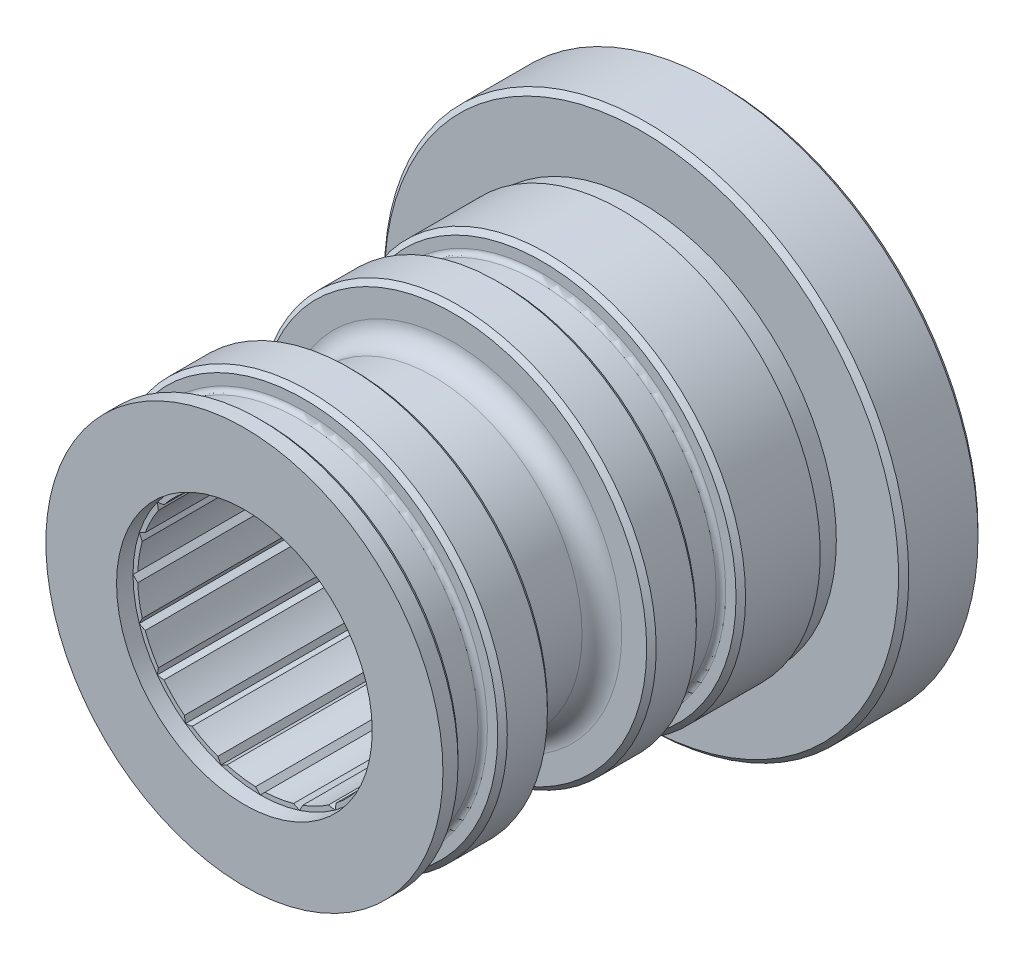
from build123d import *

# Parameters (mm, degrees)
SKETCH1_R              = 31.75
EXTRUDE1_DEPTH         = 76.2
SKETCH3_R              = 20.44096729
CUT_EXTRUDE1_DEPTH     = 2.54
CUT_EXTRUDE1_DRAFT     = -2
CUT_EXTRUDE2_DEPTH     = 27.94
CIRPATTERN1_COUNT      = 20
SKETCH5_R              = 19.60508264
CUT_EXTRUDE3_DEPTH     = 1.524
CUT_EXTRUDE3_DRAFT     = -2
FILLET1_R              = 0.8128
SKETCH7_R              = 41.91424822
EXTRUDE2_DEPTH         = 12.7
CHAMFER1_SIZE          = 0.8128
SKETCH8_W              = 0.8128
SKETCH8_H              = 3.175
COUNTERBORE1_OUTLINE_R = 25.4
COUNTERBORE1_DEPTH     = 9.525


# Read off the part's stored shape, not the designer's step: CounterBore1
with BuildPart() as part:
    # Sketch1 → Extrude1 (new body)
    with BuildSketch(Plane.XY):
        Circle(SKETCH1_R)
    extrude(amount=EXTRUDE1_DEPTH)


with BuildPart() as cut_extrude1_tool:
    # Sketch3 → Cut-Extrude1 (with draft: the straight prism first)
    with BuildSketch(Plane.XY.offset(76.2)):
        Circle(SKETCH3_R)
    extrude(amount=-CUT_EXTRUDE1_DEPTH)
    # Cut-Extrude1: the draft: its side faces are tilted about the plane it starts from
    cut_extrude1_sides = [cut_extrude1_tool.faces().sort_by_distance(p)[0] for p in [
        (-20.44096729, 0, 74.93),
    ]]
    draft(cut_extrude1_sides, Plane.XY.offset(76.2), CUT_EXTRUDE1_DRAFT)


with BuildPart() as part_1:
    add(part.part)

    # Cut-Extrude1: cut by cut_extrude1_tool
    add(cut_extrude1_tool.part, mode=Mode.SUBTRACT)

    # Sketch4 → Cut-Extrude2 (cut)
    with BuildSketch(Plane.XY.offset(73.66)):
        with BuildLine():
            Line((20.352268536, 0), (19.590268536, 0.762))
            ThreePointArc((19.590268536, 0.762), (-19.60508264, 0), (19.590268536, -0.762))
            Line((19.590268536, -0.762), (20.352268536, 0))
        make_face()
    cut_extrude2 = extrude(amount=-CUT_EXTRUDE2_DEPTH, mode=Mode.SUBTRACT)

    # CirPattern1: Cut-Extrude2 ×20 about axis
    cirpattern1_axis = Axis((0, 0, 0), (0, 0, 1))
    for i in range(1, CIRPATTERN1_COUNT):
        add(cut_extrude2.rotate(cirpattern1_axis, i * 360 / CIRPATTERN1_COUNT), mode=Mode.SUBTRACT)


with BuildPart() as cut_extrude3_tool:
    # Sketch5 → Cut-Extrude3 (with draft: the straight prism first)
    with BuildSketch(Plane.XY.offset(45.72)):
        Circle(SKETCH5_R)
    extrude(amount=-CUT_EXTRUDE3_DEPTH)
    # Cut-Extrude3: the draft: its side faces are tilted about the plane it starts from
    cut_extrude3_sides = [cut_extrude3_tool.faces().sort_by_distance(p)[0] for p in [
        (-19.60508264, 0, 44.958),
    ]]
    draft(cut_extrude3_sides, Plane.XY.offset(45.72), CUT_EXTRUDE3_DRAFT)


with BuildPart() as part_2:
    add(part_1.part)

    # Cut-Extrude3: cut by cut_extrude3_tool
    add(cut_extrude3_tool.part, mode=Mode.SUBTRACT)

    # Fillet1
    fillet1_edges = [part_2.edges().sort_by_distance(p)[0] for p in [
        (-19.551863387, 0, 44.196),
    ]]
    fillet(fillet1_edges, radius=FILLET1_R)

    # Sketch6 → Cut-Revolve1 (revolve, cut)
    with BuildSketch(Plane(origin=(0, 0, 0), x_dir=(0, 0, -1), z_dir=(1, 0, 0)), mode=Mode.PRIVATE) as cut_revolve1_sk:
        with BuildLine():
            Line((-65.913, 31.75), (-59.4995, 31.75))
            Line((-59.4995, 31.75), (-58.7375, 30.988))
            Line((-58.7375, 30.988), (-58.7375, 27.0002))
            ThreePointArc((-58.7375, 27.0002), (-57.80756403, 24.75513597), (-55.5625, 23.8252))
            Line((-55.5625, 23.8252), (-46.0375, 23.8252))
            ThreePointArc((-46.0375, 23.8252), (-43.79243597, 24.75513597), (-42.8625, 27.0002))
            Line((-42.8625, 27.0002), (-42.8625, 30.988))
            Line((-42.8625, 30.988), (-42.1005, 31.75))
            Line((-42.1005, 31.75), (-35.687, 31.75))
            Line((-35.687, 31.75), (-34.925, 30.988))
            Line((-34.925, 30.988), (-34.925, 29.337))
            ThreePointArc((-34.925, 29.337), (-34.701815367, 28.798184633), (-34.163, 28.575))
            Line((-34.163, 28.575), (-29.337, 28.575))
            ThreePointArc((-29.337, 28.575), (-28.798184633, 28.798184633), (-28.575, 29.337))
            Line((-28.575, 29.337), (-28.575, 30.988))
            Line((-28.575, 30.988), (-27.813, 31.75))
            Line((-27.813, 31.75), (-24.638309625, 31.75))
            Line((-24.638309625, 31.75), (-24.638309625, 40.707707425))
            Line((-24.638309625, 40.707707425), (-76.2, 40.707707425))
            Line((-76.2, 40.707707425), (-76.2, 31.75))
            Line((-76.2, 31.75), (-73.787, 31.75))
            Line((-73.787, 31.75), (-73.025, 30.988))
            Line((-73.025, 30.988), (-73.025, 29.337))
            ThreePointArc((-73.025, 29.337), (-72.801815367, 28.798184633), (-72.263, 28.575))
            Line((-72.263, 28.575), (-67.437, 28.575))
            ThreePointArc((-67.437, 28.575), (-66.898184633, 28.798184633), (-66.675, 29.337))
            Line((-66.675, 29.337), (-66.675, 30.988))
            Line((-66.675, 30.988), (-65.913, 31.75))
        make_face()
    revolve(cut_revolve1_sk.sketch.rotate(Axis((0, 0, 76.2), (0, 0, -1)), 90), axis=Axis((0, 0, 76.2), (0, 0, -1)), mode=Mode.SUBTRACT)

    # Sketch7 → Extrude2 (add)
    with BuildSketch(Plane(origin=(0, 0, 0), x_dir=(-1, 0, 0), z_dir=(0, 0, -1))):
        Circle(SKETCH7_R)
    extrude(amount=-EXTRUDE2_DEPTH)

    # Chamfer1
    chamfer1_edges = [part_2.edges().sort_by_distance(p)[0] for p in [
        (41.91424822, 0, 0),
        (41.91424822, 0, 12.7),
    ]]
    chamfer(chamfer1_edges, length=CHAMFER1_SIZE)

    # Sketch8 → Cut-Revolve2 (revolve, cut)
    with BuildSketch(Plane(origin=(0, 0, 0), x_dir=(1, 0, 0), z_dir=(0, 1, 0)), mode=Mode.PRIVATE) as cut_revolve2_sk:
        with Locations((31.556035197, -14.2875)):
            Rectangle(SKETCH8_W, SKETCH8_H)
    revolve(cut_revolve2_sk.sketch.rotate(Axis((0, 0, 0), (0, 0, 1)), 180), axis=Axis((0, 0, 0), (0, 0, 1)), mode=Mode.SUBTRACT)

    # CounterBore1 outline → CounterBore1 (cut)
    with BuildSketch(Plane.XY):
        Circle(COUNTERBORE1_OUTLINE_R)
    extrude(amount=COUNTERBORE1_DEPTH, mode=Mode.SUBTRACT)


solid = part_2.part
